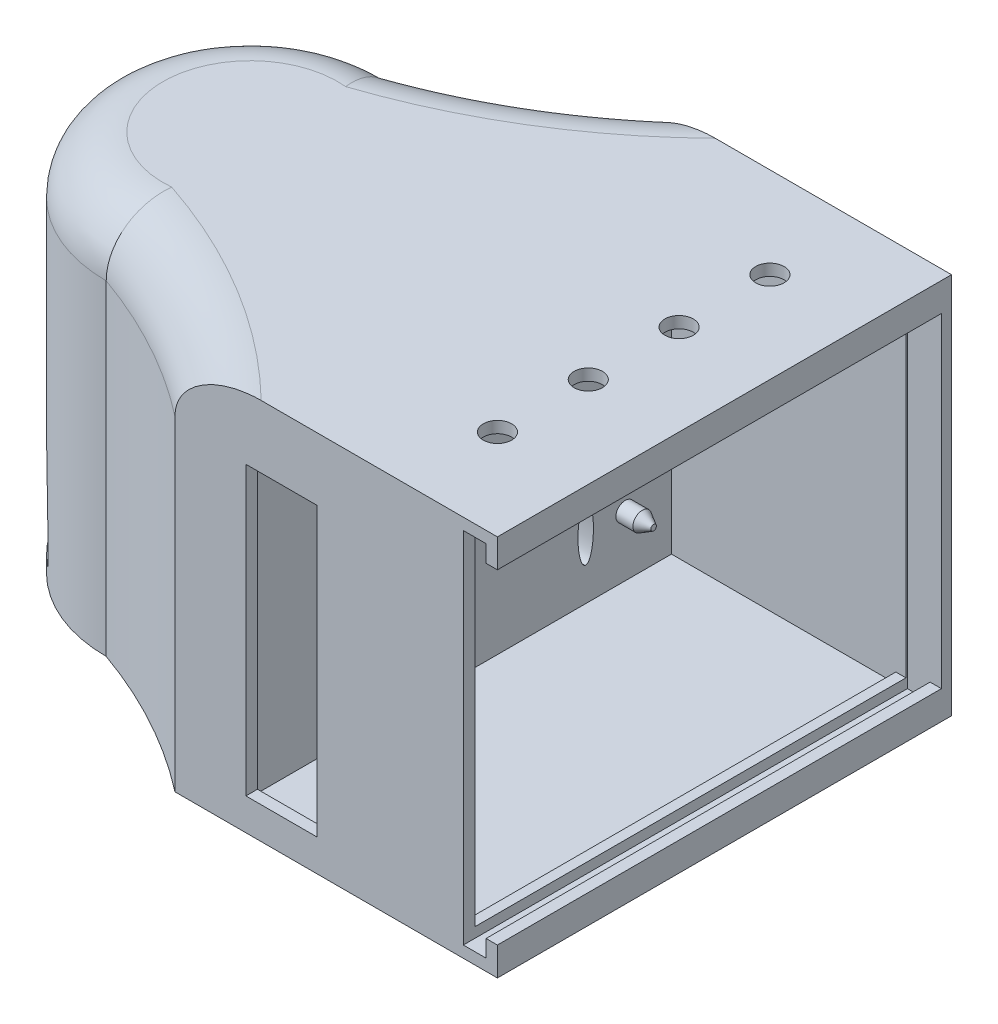
from build123d import *
from OCP.BRepFilletAPI import BRepFilletAPI_MakeChamfer

# Parameters (mm, degrees)
BOSS_EXTRUDE2_DEPTH     = 67.31
FILLET1_R               = 10
SKETCH2_W               = 75.946
SKETCH2_H               = 63.246
CUT_EXTRUDE1_DEPTH      = 41.31
SKETCH3_R               = 1.651
BOSS_EXTRUDE3_DEPTH     = 5
CHAMFER1_SIZE           = 2
CHAMFER1_SIZE2          = 1.154700538
CUT_EXTRUDE3_DEPTH      = 52
CUT_EXTRUDE4_DEPTH      = 25
CUT_EXTRUDE4_DEPTH_BACK = 25
SKETCH7_W               = 21
SKETCH7_H               = 14
SKETCH8_RX              = 4.869968375
SKETCH8_RY              = 1.367382804
CUT_EXTRUDE5_DEPTH      = 101.583585433
SKETCH5_W               = 12.523018164
SKETCH5_H               = 50.606900969
CUT_EXTRUDE6_DEPTH      = 10
SKETCH9_R               = 2.5
CUT_EXTRUDE7_DEPTH      = 10
SKETCH10_W              = 80.01
SKETCH10_H              = 2.032
BOSS_EXTRUDE4_DEPTH     = 6
SKETCH11_W              = 2
SKETCH11_H              = 80.01
BOSS_EXTRUDE6_DEPTH     = 3
SKETCH12_W              = 2
SKETCH12_H              = 80.01
BOSS_EXTRUDE7_DEPTH     = 3
SKETCH13_W              = 1.778
SKETCH13_H              = 75.946
BOSS_EXTRUDE8_DEPTH     = 1.778
SKETCH14_W              = 1.778
SKETCH14_H              = 75.946
BOSS_EXTRUDE9_DEPTH     = 1.778
BOSS_EXTRUDE10_DEPTH    = 1.778


with BuildPart() as part:
    # Sketch1 → Boss-Extrude2 (new body)
    with BuildSketch(Plane(origin=(0, 0, 0), x_dir=(1, 0, 0), z_dir=(0, 1, 0))):
        with BuildLine():
            Line((28.512569605, 26.806942292), (-22.287430395, 26.806942292))
            ThreePointArc((-22.287430395, 26.806942292), (-35.064642425, 18.429570328), (-49.016493819, 12.201942292))
            ThreePointArc((-49.016493819, 12.201942292), (-74.416493819, -13.198057708), (-49.016493819, -38.598057708))
            ThreePointArc((-49.016493819, -38.598057708), (-35.064642425, -44.825685743), (-22.287430395, -53.203057708))
            Line((-22.287430395, -53.203057708), (28.512569605, -53.203057708))
            Line((28.512569605, -53.203057708), (28.512569605, 26.806942292))
        make_face()
    extrude(amount=BOSS_EXTRUDE2_DEPTH)

    # Fillet1
    fillet1_edges = [part.edges().sort_by_distance(p)[0] for p in [
        (-35.064642425, 67.31, 44.825685743),
        (-74.416493819, 67.31, 13.198057708),
        (-35.064642425, 67.31, -18.429570328),
    ]]
    fillet(fillet1_edges, radius=FILLET1_R)

    # Sketch2 → Cut-Extrude1 (cut)
    with BuildSketch(Plane(origin=(28.512569605, 0, 0), x_dir=(0, 0, -1), z_dir=(1, 0, 0))):
        with Locations((-13.198057708, 33.655)):
            Rectangle(SKETCH2_W, SKETCH2_H)
    extrude(amount=-CUT_EXTRUDE1_DEPTH, mode=Mode.SUBTRACT)

    # Sketch3 → Boss-Extrude3 (add)
    with BuildSketch(Plane(origin=(-12.797430395, 0, 0), x_dir=(0, 0, -1), z_dir=(1, 0, 0))):
        with Locations((-34.171057708, 55.824657448)):
            Circle(SKETCH3_R)
        with Locations((-34.171057708, 7.564657448)):
            Circle(SKETCH3_R)
        with Locations((16.628942292, 40.584657448)):
            Circle(SKETCH3_R)
        with Locations((16.628942292, 12.644657448)):
            Circle(SKETCH3_R)
    extrude(amount=BOSS_EXTRUDE3_DEPTH)

    # Chamfer1: one chamfer whose edges measure the first distance from different faces: ONE call of the kernel's chamfer builder (chamfer() names one face for all edges)
    chamfer1_edges_1 = [part.edges().sort_by_distance(p)[0] for p in [
        (-7.797430395, 12.644657448, -14.977942292),
    ]]
    chamfer1_side_1 = [part.faces().sort_by_distance(p)[0] for p in [
        (-10.297430395, 12.644657448, -14.977942292),
    ]]
    chamfer1_edges_2 = [part.edges().sort_by_distance(p)[0] for p in [
        (-7.797430395, 40.584657448, -14.977942292),
    ]]
    chamfer1_side_2 = [part.faces().sort_by_distance(p)[0] for p in [
        (-10.297430395, 40.584657448, -14.977942292),
    ]]
    chamfer1_edges_3 = [part.edges().sort_by_distance(p)[0] for p in [
        (-7.797430395, 55.824657448, 35.822057708),
    ]]
    chamfer1_side_3 = [part.faces().sort_by_distance(p)[0] for p in [
        (-10.297430395, 55.824657448, 35.822057708),
    ]]
    chamfer1_edges_4 = [part.edges().sort_by_distance(p)[0] for p in [
        (-7.797430395, 7.564657448, 35.822057708),
    ]]
    chamfer1_side_4 = [part.faces().sort_by_distance(p)[0] for p in [
        (-10.297430395, 7.564657448, 35.822057708),
    ]]
    chamfer1 = BRepFilletAPI_MakeChamfer(part.part.solid().wrapped)
    for e in chamfer1_edges_1:
        chamfer1.Add(CHAMFER1_SIZE, CHAMFER1_SIZE2, e.wrapped, chamfer1_side_1[0].wrapped)  # the first distance lies on this face
    for e in chamfer1_edges_2:
        chamfer1.Add(CHAMFER1_SIZE, CHAMFER1_SIZE2, e.wrapped, chamfer1_side_2[0].wrapped)  # the first distance lies on this face
    for e in chamfer1_edges_3:
        chamfer1.Add(CHAMFER1_SIZE, CHAMFER1_SIZE2, e.wrapped, chamfer1_side_3[0].wrapped)  # the first distance lies on this face
    for e in chamfer1_edges_4:
        chamfer1.Add(CHAMFER1_SIZE, CHAMFER1_SIZE2, e.wrapped, chamfer1_side_4[0].wrapped)  # the first distance lies on this face
    add(Compound.cast(chamfer1.Shape()), mode=Mode.REPLACE)

    # Sketch4 → Cut-Extrude3 (cut)
    with BuildSketch(Plane(origin=(-76.2, 0, 0), x_dir=(0, 0, -1), z_dir=(1, 0, 0))):
        with BuildLine():
            Line((6.890730221, 2.888701934), (-33.286845636, 2.888701934))
            add(Edge.make_bspline(
                [(6.890730221, 2.888701934), (6.890730221, 51.375976578), (-13.198057708, 51.375976578), (-33.286845636, 51.375976578), (-33.286845636, 2.888701934)],
                knots=[4.71238898, 4.71238898, 4.71238898, 6.283185307, 6.283185307, 7.853981634, 7.853981634, 7.853981634], degree=2, weights=[1, 0.707106781, 1, 0.707106781, 1]))
        make_face()
    extrude(amount=CUT_EXTRUDE3_DEPTH, mode=Mode.SUBTRACT)

    # Sketch7 → Cut-Extrude4 (cut, two sides: drawn at the far end of the back side and taken through both)
    with BuildSketch(Plane.XY.offset(13.198057708).offset(-CUT_EXTRUDE4_DEPTH_BACK)):
        with Locations((-34.483679543, 12.643548946)):
            Rectangle(SKETCH7_W, SKETCH7_H)
    extrude(amount=CUT_EXTRUDE4_DEPTH + CUT_EXTRUDE4_DEPTH_BACK, mode=Mode.SUBTRACT)

    # Sketch8 → Cut-Extrude5 (cut, through all)
    with BuildSketch(Plane.ZY.offset(23.983679543)):
        with Locations(Location((-9.66538742, 12.775075764), (0, 0, -90))):
            Ellipse(SKETCH8_RX, SKETCH8_RY)
        with Locations(Location((35.24218315, 12.775075764), (0, 0, -90))):
            Ellipse(SKETCH8_RX, SKETCH8_RY)
    extrude(amount=-CUT_EXTRUDE5_DEPTH, mode=Mode.SUBTRACT)

    # Sketch5 → Cut-Extrude6 (cut)
    with BuildSketch(Plane.XY.offset(53.203057708)):
        with Locations((-3.535921313, 30.927861241)):
            Rectangle(SKETCH5_W, SKETCH5_H)
    extrude(amount=-CUT_EXTRUDE6_DEPTH, mode=Mode.SUBTRACT)

    # Sketch9 → Cut-Extrude7 (cut)
    with BuildSketch(Plane(origin=(0, 67.31, 0), x_dir=(1, 0, 0), z_dir=(0, 1, 0))):
        with Locations((18.512569605, -37.193057708)):
            Circle(SKETCH9_R)
        with Locations((18.512569605, -21.193057708)):
            Circle(SKETCH9_R)
        with Locations((18.512569605, -5.193057708)):
            Circle(SKETCH9_R)
        with Locations((18.512569605, 10.806942292)):
            Circle(SKETCH9_R)
    extrude(amount=-CUT_EXTRUDE7_DEPTH, mode=Mode.SUBTRACT)

    # Sketch10 → Boss-Extrude4 (add)
    with BuildSketch(Plane(origin=(28.512569605, 0, 0), x_dir=(0, 0, -1), z_dir=(1, 0, 0))):
        with Locations((-13.198057708, 66.294)):
            Rectangle(SKETCH10_W, SKETCH10_H)
        with Locations((-13.198057708, 1.016)):
            Rectangle(SKETCH10_W, SKETCH10_H)
    extrude(amount=BOSS_EXTRUDE4_DEPTH)

    # Sketch11 → Boss-Extrude6 (add)
    with BuildSketch(Plane.XZ.offset(-65.278)):
        with Locations((33.512569605, 13.198057708)):
            Rectangle(SKETCH11_W, SKETCH11_H)
    extrude(amount=BOSS_EXTRUDE6_DEPTH)

    # Sketch12 → Boss-Extrude7 (add)
    with BuildSketch(Plane(origin=(0, 2.032, 0), x_dir=(1, 0, 0), z_dir=(0, 1, 0))):
        with Locations((33.512569605, -13.198057708)):
            Rectangle(SKETCH12_W, SKETCH12_H)
    extrude(amount=BOSS_EXTRUDE7_DEPTH)

    # Sketch13 → Boss-Extrude8 (add)
    with BuildSketch(Plane(origin=(0, 2.032, 0), x_dir=(1, 0, 0), z_dir=(0, 1, 0))):
        with Locations((27.623569605, -13.198057708)):
            Rectangle(SKETCH13_W, SKETCH13_H)
    extrude(amount=BOSS_EXTRUDE8_DEPTH)

    # Sketch14 → Boss-Extrude9 (add)
    with BuildSketch(Plane.XZ.offset(-65.278)):
        with Locations((27.623569605, 13.198057708)):
            Rectangle(SKETCH14_W, SKETCH14_H)
    extrude(amount=BOSS_EXTRUDE9_DEPTH)

    # Sketch15 → Boss-Extrude10 (add)
    with BuildSketch(Plane(origin=(0, 0, -26.806942292), x_dir=(-1, 0, 0), z_dir=(0, 0, -1))):
        Polygon((-34.512569605, 5.032), (-34.512569605, 62.278), (-32.512569605, 62.278), (-32.512569605, 65.278), (-28.512569605, 65.278), (-28.512569605, 2.032), (-32.512569605, 2.032), (-32.512569605, 5.032), align=None)
    extrude(amount=-BOSS_EXTRUDE10_DEPTH)


solid = part.part
